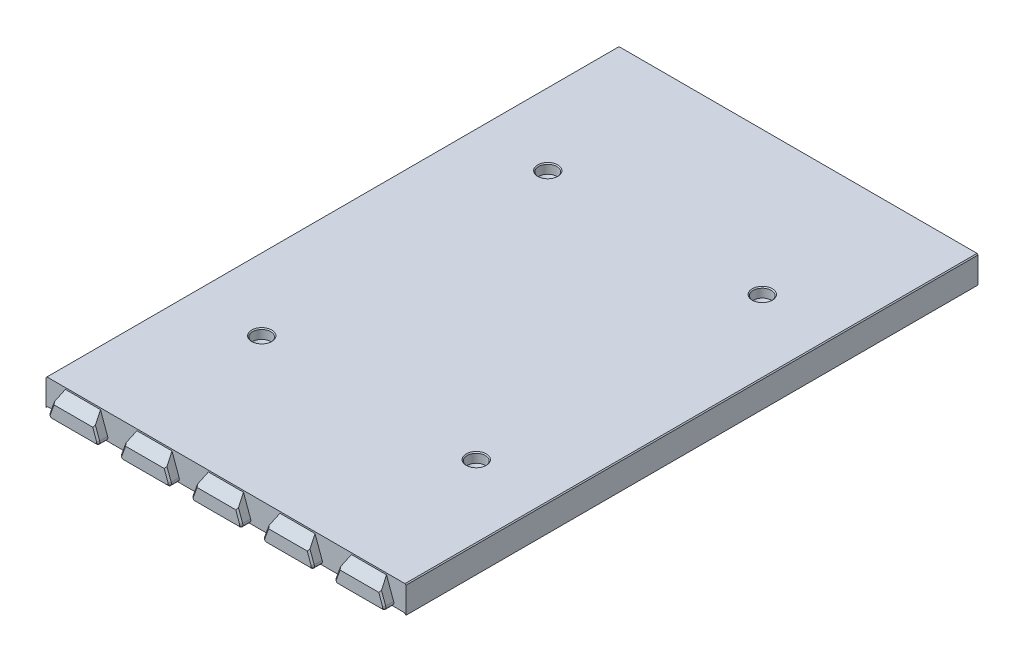
from build123d import *

# Parameters (mm, degrees)
BOSS_EXTRUDE1_DEPTH             = 90
SKETCH7_W                       = 109.25
SKETCH7_H                       = 6
BOSS_EXTRUDE7_DEPTH             = 1
BOSS_EXTRUDE4_DEPTH             = 3
BOSS_EXTRUDE8_REACH             = 108.632
BOSS_EXTRUDE8_DIRECTION_2_DEPTH = 2
CHAMFER4_SIZE                   = 0.5
FILLET4_R                       = 1
CHAMFER6_SIZE                   = 0.5
FILLET2_R                       = 2
CHAMFER4_OF_MIRROR2_SIZE        = 0.5
FILLET4_OF_MIRROR2_R            = 1
CHAMFER6_OF_MIRROR2_SIZE        = 0.5
FILLET2_OF_MIRROR2_R            = 2
BOSS_EXTRUDE9_REACH             = 193.727
SKETCH9_R                       = 5
FILLET3_R                       = 3
SKETCH10_R                      = 1.85
CUT_EXTRUDE2_DEPTH              = 192.727386215
SKETCH11_R                      = 2.85
CUT_EXTRUDE3_DEPTH              = 3
CHAMFER7_SIZE                   = 1
CUT_EXTRUDE4_DEPTH              = 192.727386215
CUT_EXTRUDE4_DEPTH_BACK         = 192.727386215
BOSS_EXTRUDE10_DEPTH            = 180
CHAMFER8_SIZE                   = 0.3


with BuildPart() as part:
    # Sketch1 → Boss-Extrude1 (new body)
    with BuildSketch(Plane.XY):
        Polygon((-56.625, 0), (-56.625, 8), (56.625, 8), (56.625, 0), (54.625, 0), (54.625, 6), (-54.625, 6), (-54.625, 0), align=None)
    boss_extrude1 = extrude(amount=-BOSS_EXTRUDE1_DEPTH)

    # Sketch7 → Boss-Extrude7 (add)
    with BuildSketch(Plane.XY):
        with Locations((0, 3)):
            Rectangle(SKETCH7_W, SKETCH7_H)
    boss_extrude7 = extrude(amount=-BOSS_EXTRUDE7_DEPTH)

    # Sketch2 → Boss-Extrude4 (add)
    with BuildSketch(Plane.XY):
        Polygon((39.661761874, 8), (36.75, 0), (53.25, 0), (50.338238126, 8), align=None)
        Polygon((17.161761874, 8), (14.25, 0), (30.75, 0), (27.838238126, 8), align=None)
        Polygon((-5.338238126, 8), (-8.25, 0), (8.25, 0), (5.338238126, 8), align=None)
        Polygon((-27.838238126, 8), (-30.75, 0), (-14.25, 0), (-17.161761874, 8), align=None)
        Polygon((-50.338238126, 8), (-53.25, 0), (-36.75, 0), (-39.661761874, 8), align=None)
    boss_extrude4 = extrude(amount=BOSS_EXTRUDE4_DEPTH)

    # Sketch8 → Boss-Extrude8 (add, up to next)
    with BuildSketch(Plane.XZ, mode=Mode.PRIVATE) as boss_extrude8_sk1:
        Polygon((-55.1, -24.741658736), (-51.4, -23.394968869), (-51.4, -21.605031131), (-55.1, -20.258341264), align=None)
    boss_extrude8_tool1 = extrude(boss_extrude8_sk1.sketch, amount=-BOSS_EXTRUDE8_REACH, mode=Mode.PRIVATE) - part.part
    # Sketch8 → Boss-Extrude8 (add, up to next)
    with BuildSketch(Plane.XZ, mode=Mode.PRIVATE) as boss_extrude8_sk2:
        Polygon((-55.1, -87.758341264), (-51.4, -89.105031131), (-51.4, -89.85), (-51.4, -90), (-55.1, -90), (-55.1, -89.85), align=None)
    boss_extrude8_tool2 = extrude(boss_extrude8_sk2.sketch, amount=-BOSS_EXTRUDE8_REACH, mode=Mode.PRIVATE) - part.part
    # Sketch8 → Boss-Extrude8 (add, up to next)
    with BuildSketch(Plane.XZ, mode=Mode.PRIVATE) as boss_extrude8_sk3:
        Polygon((55.1, -90), (51.4, -90), (51.4, -89.85), (51.4, -89.105031131), (55.1, -87.758341264), (55.1, -89.85), align=None)
    boss_extrude8_tool3 = extrude(boss_extrude8_sk3.sketch, amount=-BOSS_EXTRUDE8_REACH, mode=Mode.PRIVATE) - part.part
    # Sketch8 → Boss-Extrude8 (add, up to next)
    with BuildSketch(Plane.XZ, mode=Mode.PRIVATE) as boss_extrude8_sk4:
        Polygon((55.1, -24.741658736), (55.1, -20.258341264), (51.4, -21.605031131), (51.4, -23.394968869), align=None)
    boss_extrude8_tool4 = extrude(boss_extrude8_sk4.sketch, amount=-BOSS_EXTRUDE8_REACH, mode=Mode.PRIVATE) - part.part
    boss_extrude8_1 = boss_extrude8_tool1.solids().sort_by_distance((-53.514762, 0, -22.5))[0]
    add(boss_extrude8_1)
    boss_extrude8_2 = boss_extrude8_tool2.solids().sort_by_distance((-53.514762, 0, -89.16766))[0]
    add(boss_extrude8_2)
    boss_extrude8_3 = boss_extrude8_tool3.solids().sort_by_distance((53.514762, 0, -89.16766))[0]
    add(boss_extrude8_3)
    boss_extrude8_4 = boss_extrude8_tool4.solids().sort_by_distance((53.514762, 0, -22.5))[0]
    add(boss_extrude8_4)
    boss_extrude8 = boss_extrude8_1 + boss_extrude8_2 + boss_extrude8_3 + boss_extrude8_4  # Boss-Extrude8 as one shape, for the pattern or mirror that repeats it

    # Sketch8 → Boss-Extrude8 direction 2 (add)
    with BuildSketch(Plane.XZ):
        Polygon((-55.1, -24.741658736), (-51.4, -23.394968869), (-51.4, -21.605031131), (-55.1, -20.258341264), align=None)
        Polygon((-55.1, -87.758341264), (-51.4, -89.105031131), (-51.4, -89.85), (-51.4, -90), (-55.1, -90), (-55.1, -89.85), align=None)
        Polygon((55.1, -90), (51.4, -90), (51.4, -89.85), (51.4, -89.105031131), (55.1, -87.758341264), (55.1, -89.85), align=None)
        Polygon((55.1, -24.741658736), (55.1, -20.258341264), (51.4, -21.605031131), (51.4, -23.394968869), align=None)
    boss_extrude8_direction_2 = extrude(amount=BOSS_EXTRUDE8_DIRECTION_2_DEPTH)

    # Chamfer4
    chamfer4_edges = [part.edges().sort_by_distance(p)[0] for p in [
        (-55.1, -2, -22.5),
        (-53.25, -2, -24.068313803),
        (-51.4, -2, -22.5),
        (-53.25, -2, -20.931686197),
        (-55.1, -2, -88.879170632),
        (-51.4, -2, -89.552515565),
        (-53.25, -2, -88.431686197),
        (55.1, -2, -88.879170632),
        (53.25, -2, -88.431686197),
        (51.4, -2, -89.552515565),
        (51.4, -2, -22.5),
        (53.25, -2, -24.068313803),
        (55.1, -2, -22.5),
        (53.25, -2, -20.931686197),
    ]]
    chamfer(chamfer4_edges, length=CHAMFER4_SIZE)

    # Fillet4
    fillet4_edges = [part.edges().sort_by_distance(p)[0] for p in [
        (36.75, 0, 1.5),
        (53.25, 0, 1.5),
        (14.25, 0, 1.5),
        (30.75, 0, 1.5),
        (-8.25, 0, 1.5),
        (8.25, 0, 1.5),
        (-53.25, 0, 1.5),
        (-36.75, 0, 1.5),
        (-30.75, 0, 1.5),
        (-14.25, 0, 1.5),
    ]]
    fillet(fillet4_edges, radius=FILLET4_R)

    # Chamfer6
    chamfer6_edges = [part.edges().sort_by_distance(p)[0] for p in [
        (51.54989137, 4.671010072, 3),
        (45, 0, 3),
        (22.5, 0, 3),
        (0, 0, 3),
        (-22.5, 0, 3),
        (-45, 0, 3),
        (37.358995962, 0.426423564, 3),
        (52.641004038, 0.426423564, 3),
        (29.04989137, 4.671010072, 3),
        (14.858995962, 0.426423564, 3),
        (30.141004038, 0.426423564, 3),
        (6.54989137, 4.671010072, 3),
        (-7.641004038, 0.426423564, 3),
        (7.641004038, 0.426423564, 3),
        (-15.95010863, 4.671010072, 3),
        (-30.141004038, 0.426423564, 3),
        (-14.858995962, 0.426423564, 3),
        (-38.45010863, 4.671010072, 3),
        (-52.641004038, 0.426423564, 3),
        (-37.358995962, 0.426423564, 3),
        (38.45010863, 4.671010072, 3),
        (15.95010863, 4.671010072, 3),
        (-6.54989137, 4.671010072, 3),
        (-51.54989137, 4.671010072, 3),
        (-29.04989137, 4.671010072, 3),
    ]]
    chamfer(chamfer6_edges, length=CHAMFER6_SIZE)

    # Fillet2
    fillet2_edges = [part.edges().sort_by_distance(p)[0] for p in [
        (-54.625, 6, -10.715613563),
        (-53.0125, 6, -23.981870872),
        (-53.0125, 6, -21.018129128),
        (-51.4, 6, -22.5),
        (-54.625, 6, -56.25),
        (-51.4, 6, -89.552515565),
        (-53.0125, 6, -88.518129128),
        (54.625, 6, -56.25),
        (54.625, 3, -87.931227125),
        (53.0125, 6, -88.518129128),
        (51.4, 6, -89.552515565),
        (54.625, 6, -10.715613563),
        (54.625, 3, -24.568772875),
        (53.0125, 6, -23.981870872),
        (51.4, 6, -22.5),
        (53.0125, 6, -21.018129128),
        (-54.625, 3, -1),
        (0, 6, -1),
        (54.625, 3, -1),
    ]]
    fillet(fillet2_edges, radius=FILLET2_R)


with BuildPart() as mirror2_1:
    # Mirror2: Boss-Extrude1, Boss-Extrude7, Boss-Extrude4, Boss-Extrude8, Boss-Extrude8 direction 2 across plane
    add(boss_extrude1.mirror(Plane.XY.offset(-90)))
    add(boss_extrude7.mirror(Plane.XY.offset(-90)))
    add(boss_extrude4.mirror(Plane.XY.offset(-90)))
    add(boss_extrude8.mirror(Plane.XY.offset(-90)))
    add(boss_extrude8_direction_2.mirror(Plane.XY.offset(-90)))

    # Chamfer4 of Mirror2
    chamfer4_of_mirror2_edges = [mirror2_1.edges().sort_by_distance(p)[0] for p in [
        (-55.1, -2, -157.5),
        (-53.25, -2, -155.931686197),
        (-51.4, -2, -157.5),
        (-53.25, -2, -159.068313803),
        (-55.1, -2, -91.120829368),
        (-51.4, -2, -90.447484435),
        (-53.25, -2, -91.568313803),
        (55.1, -2, -91.120829368),
        (53.25, -2, -91.568313803),
        (51.4, -2, -90.447484435),
        (51.4, -2, -157.5),
        (53.25, -2, -155.931686197),
        (55.1, -2, -157.5),
        (53.25, -2, -159.068313803),
    ]]
    chamfer(chamfer4_of_mirror2_edges, length=CHAMFER4_OF_MIRROR2_SIZE)

    # Fillet4 of Mirror2
    fillet4_of_mirror2_edges = [mirror2_1.edges().sort_by_distance(p)[0] for p in [
        (36.75, 0, -181.5),
        (53.25, 0, -181.5),
        (14.25, 0, -181.5),
        (30.75, 0, -181.5),
        (-8.25, 0, -181.5),
        (8.25, 0, -181.5),
        (-53.25, 0, -181.5),
        (-36.75, 0, -181.5),
        (-30.75, 0, -181.5),
        (-14.25, 0, -181.5),
    ]]
    fillet(fillet4_of_mirror2_edges, radius=FILLET4_OF_MIRROR2_R)

    # Chamfer6 of Mirror2
    chamfer6_of_mirror2_edges = [mirror2_1.edges().sort_by_distance(p)[0] for p in [
        (51.54989137, 4.671010072, -183),
        (45, 0, -183),
        (22.5, 0, -183),
        (0, 0, -183),
        (-22.5, 0, -183),
        (-45, 0, -183),
        (37.358995962, 0.426423564, -183),
        (52.641004038, 0.426423564, -183),
        (29.04989137, 4.671010072, -183),
        (14.858995962, 0.426423564, -183),
        (30.141004038, 0.426423564, -183),
        (6.54989137, 4.671010072, -183),
        (-7.641004038, 0.426423564, -183),
        (7.641004038, 0.426423564, -183),
        (-15.95010863, 4.671010072, -183),
        (-30.141004038, 0.426423564, -183),
        (-14.858995962, 0.426423564, -183),
        (-38.45010863, 4.671010072, -183),
        (-52.641004038, 0.426423564, -183),
        (-37.358995962, 0.426423564, -183),
        (38.45010863, 4.671010072, -183),
        (15.95010863, 4.671010072, -183),
        (-6.54989137, 4.671010072, -183),
        (-51.54989137, 4.671010072, -183),
        (-29.04989137, 4.671010072, -183),
    ]]
    chamfer(chamfer6_of_mirror2_edges, length=CHAMFER6_OF_MIRROR2_SIZE)

    # Fillet2 of Mirror2
    fillet2_of_mirror2_edges = [mirror2_1.edges().sort_by_distance(p)[0] for p in [
        (-54.625, 6, -169.284386437),
        (-53.0125, 6, -156.018129128),
        (-53.0125, 6, -158.981870872),
        (-51.4, 6, -157.5),
        (-54.625, 6, -123.75),
        (-51.4, 6, -90.447484435),
        (-53.0125, 6, -91.481870872),
        (54.625, 6, -123.75),
        (54.625, 3, -92.068772875),
        (53.0125, 6, -91.481870872),
        (51.4, 6, -90.447484435),
        (54.625, 6, -169.284386437),
        (54.625, 3, -155.431227125),
        (53.0125, 6, -156.018129128),
        (51.4, 6, -157.5),
        (53.0125, 6, -158.981870872),
        (-54.625, 3, -179),
        (0, 6, -179),
        (54.625, 3, -179),
    ]]
    fillet(fillet2_of_mirror2_edges, radius=FILLET2_OF_MIRROR2_R)


with BuildPart() as part_1:
    add(part.part)

    # Mirror2 united with what the copies touc: union Mirror2_1
    add(mirror2_1.part)

    # Sketch9 → Boss-Extrude9 (add, up to next)
    with BuildSketch(Plane(origin=(0, 0, 0), x_dir=(1, 0, 0), z_dir=(0, 1, 0)), mode=Mode.PRIVATE) as boss_extrude9_sk1:
        with Locations(Location((-33.75, 45, 0), (0, 0, 90))):
            Circle(SKETCH9_R)
    boss_extrude9_tool1 = extrude(boss_extrude9_sk1.sketch, amount=BOSS_EXTRUDE9_REACH, mode=Mode.PRIVATE) - part_1.part
    # Sketch9 → Boss-Extrude9 (add, up to next)
    with BuildSketch(Plane(origin=(0, 0, 0), x_dir=(1, 0, 0), z_dir=(0, 1, 0)), mode=Mode.PRIVATE) as boss_extrude9_sk2:
        with Locations(Location((33.75, 45, 0), (0, 0, 90))):
            Circle(SKETCH9_R)
    boss_extrude9_tool2 = extrude(boss_extrude9_sk2.sketch, amount=BOSS_EXTRUDE9_REACH, mode=Mode.PRIVATE) - part_1.part
    # Sketch9 → Boss-Extrude9 (add, up to next)
    with BuildSketch(Plane(origin=(0, 0, 0), x_dir=(1, 0, 0), z_dir=(0, 1, 0)), mode=Mode.PRIVATE) as boss_extrude9_sk3:
        with Locations(Location((33.75, 135, 0), (0, 0, 90))):
            Circle(SKETCH9_R)
    boss_extrude9_tool3 = extrude(boss_extrude9_sk3.sketch, amount=BOSS_EXTRUDE9_REACH, mode=Mode.PRIVATE) - part_1.part
    # Sketch9 → Boss-Extrude9 (add, up to next)
    with BuildSketch(Plane(origin=(0, 0, 0), x_dir=(1, 0, 0), z_dir=(0, 1, 0)), mode=Mode.PRIVATE) as boss_extrude9_sk4:
        with Locations(Location((-33.75, 135, 0), (0, 0, 90))):
            Circle(SKETCH9_R)
    boss_extrude9_tool4 = extrude(boss_extrude9_sk4.sketch, amount=BOSS_EXTRUDE9_REACH, mode=Mode.PRIVATE) - part_1.part
    add(boss_extrude9_tool1.solids().sort_by_distance((-33.75, 0, -45))[0])
    add(boss_extrude9_tool2.solids().sort_by_distance((33.75, 0, -45))[0])
    add(boss_extrude9_tool3.solids().sort_by_distance((33.75, 0, -135))[0])
    add(boss_extrude9_tool4.solids().sort_by_distance((-33.75, 0, -135))[0])

    # Fillet3
    fillet3_edges = [part_1.edges().sort_by_distance(p)[0] for p in [
        (-33.75, 6, -40),
        (-33.75, 6, -130),
        (33.75, 6, -130),
        (33.75, 6, -40),
    ]]
    fillet(fillet3_edges, radius=FILLET3_R)

    # Sketch10 → Cut-Extrude2 (cut, through all)
    with BuildSketch(Plane(origin=(0, 0, 0), x_dir=(1, 0, 0), z_dir=(0, 1, 0))):
        with Locations(Location((-33.75, 135, 0), (0, 0, 270))):
            Circle(SKETCH10_R)
        with Locations(Location((-33.75, 45, 0), (0, 0, 270))):
            Circle(SKETCH10_R)
        with Locations(Location((33.75, 45, 0), (0, 0, 270))):
            Circle(SKETCH10_R)
        with Locations(Location((33.75, 135, 0), (0, 0, 270))):
            Circle(SKETCH10_R)
    extrude(amount=CUT_EXTRUDE2_DEPTH, mode=Mode.SUBTRACT)

    # Sketch11 → Cut-Extrude3 (cut)
    with BuildSketch(Plane(origin=(0, 8, 0), x_dir=(1, 0, 0), z_dir=(0, 1, 0))):
        with Locations(Location((-33.75, 135, 0), (0, 0, 270))):
            Circle(SKETCH11_R)
        with Locations(Location((33.75, 135, 0), (0, 0, 270))):
            Circle(SKETCH11_R)
        with Locations(Location((33.75, 45, 0), (0, 0, 270))):
            Circle(SKETCH11_R)
        with Locations(Location((-33.75, 45, 0), (0, 0, 270))):
            Circle(SKETCH11_R)
    extrude(amount=-CUT_EXTRUDE3_DEPTH, mode=Mode.SUBTRACT)

    # Chamfer7
    chamfer7_edges = [part_1.edges().sort_by_distance(p)[0] for p in [
        (-33.75, 5, -46.85),
        (33.75, 5, -46.85),
        (33.75, 5, -136.85),
        (-33.75, 5, -136.85),
    ]]
    chamfer(chamfer7_edges, length=CHAMFER7_SIZE - 0.0001)  # a hair under: the kernel refuses the full size

    # Sketch12 → Cut-Extrude4 (cut, two sides: drawn at the far end of the back side and taken through both)
    with BuildSketch(Plane(origin=(0, 0, 0), x_dir=(0, 0, -1), z_dir=(1, 0, 0)).offset(-CUT_EXTRUDE4_DEPTH_BACK)):
        Polygon((0, 7.5), (-3, 4.5), (-3, 7.5), (-3, 8), (0, 8), align=None)
        Polygon((183, 4.5), (183, 7.5), (183, 8), (180, 8), (180, 7.5), align=None)
    extrude(amount=CUT_EXTRUDE4_DEPTH + CUT_EXTRUDE4_DEPTH_BACK, mode=Mode.SUBTRACT)

    # Sketch13 → Boss-Extrude10 (add)
    with BuildSketch(Plane(origin=(0, 0, -180), x_dir=(-1, 0, 0), z_dir=(0, 0, -1))):
        Polygon((-56.125, 0), (-56.625, -0.5), (-56.625, 0), align=None)
        Polygon((56.625, 0), (56.125, 0), (56.625, -0.5), align=None)
    extrude(amount=-BOSS_EXTRUDE10_DEPTH)

    # Chamfer8
    chamfer8_edges = [part_1.edges().sort_by_distance(p)[0] for p in [
        (-56.625, 8, -90),
        (56.625, 8, -90),
        (-33.75, 8, -47.85),
        (33.75, 8, -47.85),
        (33.75, 8, -137.85),
        (-33.75, 8, -137.85),
    ]]
    chamfer(chamfer8_edges, length=CHAMFER8_SIZE)


solid = part_1.part
